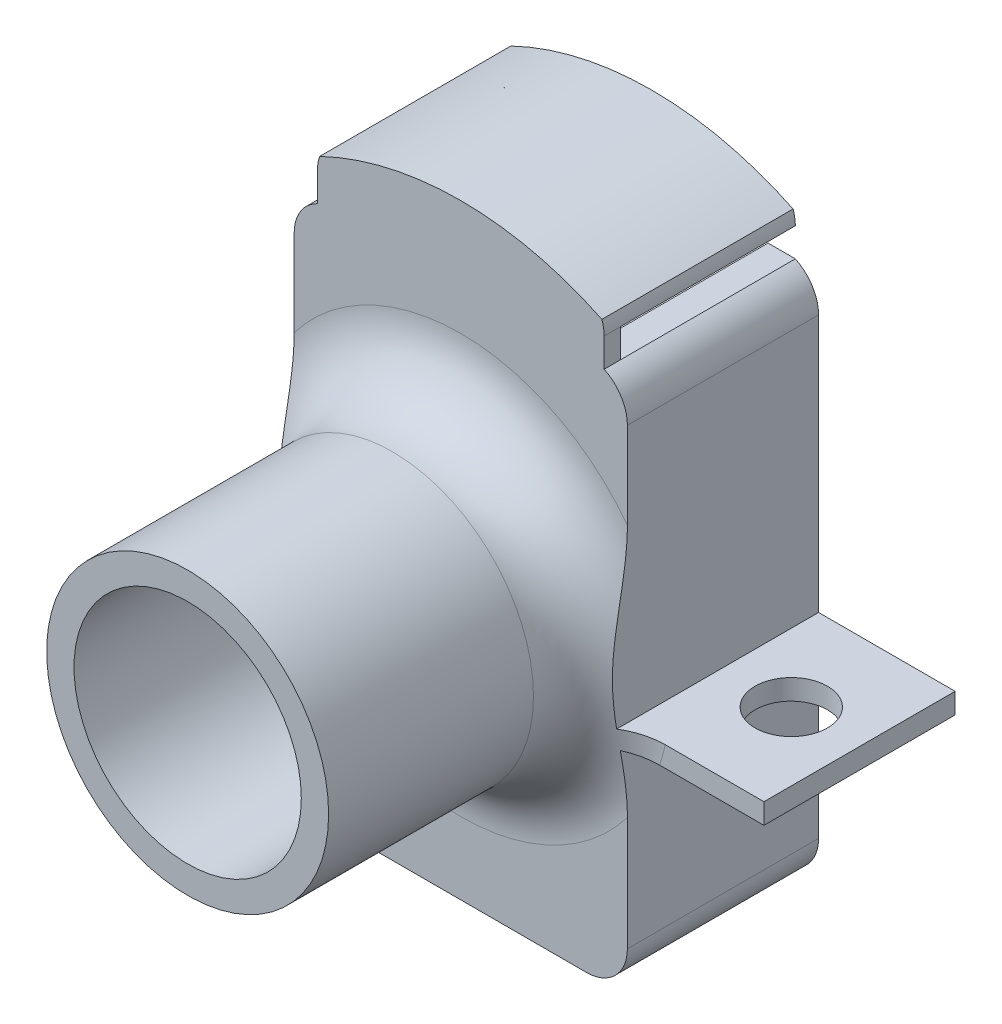
from build123d import *
from build123d.topology import SkipClean

# Parameters (mm, degrees)
SKETCH2_R             = 7.9375
BATTERY_HOLDER_DEPTH  = 16.256
CUT_EXTRUDE3_START    = -26.416
CUT_EXTRUDE3_DEPTH    = 26.416
SKETCH3_R             = 3.36804
PANEL_MOUNT_DEPTH     = 16.256
WINGS_DEPTH           = 1.27
ELECTRONIC_START      = -6.35
ELECTRONIC_AXIS_DEPTH = 6.35


with BuildPart() as part:
    # Sketch1 → Body (revolve)
    with BuildSketch(Plane(origin=(0, 0, 0), x_dir=(0, 0, -1), z_dir=(1, 0, 0))):
        with BuildLine():
            Line((0, 10.570464), (25.4, 10.570464))
            Line((25.4, 10.570464), (25.4, 7.9375))
            Line((25.4, 7.9375), (43.18, 7.9375))
            Line((43.18, 7.9375), (43.18, 30.1625))
            Line((43.18, 30.1625), (25.4, 30.1625))
            Line((25.4, 30.1625), (25.4, 19.460464))
            ThreePointArc((25.4, 19.460464), (23.540128061, 14.970335939), (19.05, 13.110464))
            Line((19.05, 13.110464), (0, 13.110464))
            Line((0, 13.110464), (0, 10.570464))
        make_face()
    revolve(axis=Axis((0, 0, 0), (0, 0, -1)))

    # Sketch2 → Battery holder (cut)
    with BuildSketch(Plane(origin=(0, 0, -43.18), x_dir=(-1, 0, 0), z_dir=(0, 0, -1))):
        with BuildLine():
            ThreePointArc((-12.954, -22.352), (-12.582025612, -23.250025612), (-11.684, -23.622))
            Line((-11.684, -23.622), (11.684, -23.622))
            ThreePointArc((11.684, -23.622), (12.582025612, -23.250025612), (12.954, -22.352))
            Line((12.954, -22.352), (12.954, 19.812))
            ThreePointArc((12.954, 19.812), (12.582025612, 20.710025612), (11.684, 21.082))
            Line((11.684, 21.082), (10.795, 21.082))
            Line((10.795, 21.082), (10.795, 25.908))
            ThreePointArc((10.795, 25.908), (10.423025612, 26.806025612), (9.525, 27.178))
            Line((9.525, 27.178), (-9.525, 27.178))
            ThreePointArc((-9.525, 27.178), (-10.423025612, 26.806025612), (-10.795, 25.908))
            Line((-10.795, 25.908), (-13.335, 25.908))
            Line((-13.335, 25.908), (-13.335, 23.245700482))
            Line((-13.335, 23.245700482), (-10.795, 23.245700482))
            Line((-10.795, 23.245700482), (-10.795, 21.082))
            Line((-10.795, 21.082), (-11.684, 21.082))
            ThreePointArc((-11.684, 21.082), (-12.582025612, 20.710025612), (-12.954, 19.812))
            Line((-12.954, 19.812), (-12.954, -22.352))
        make_face()
        Circle(SKETCH2_R, mode=Mode.SUBTRACT)
    extrude(amount=-BATTERY_HOLDER_DEPTH, mode=Mode.SUBTRACT)

    # Sketch2<3> → Cut-Extrude3 (cut)
    with BuildSketch(Plane(origin=(0, 0, -43.18), x_dir=(-1, 0, 0), z_dir=(0, 0, -1)).offset(CUT_EXTRUDE3_START)):
        with BuildLine():
            ThreePointArc((-15.494, 19.812), (-14.909399975, 21.840027367), (-13.335, 23.245700482))
            Line((-13.335, 23.245700482), (-13.335, 25.908))
            ThreePointArc((-13.335, 25.908), (-13.281952329, 26.54156862), (-13.124286511, 27.157494543))
            ThreePointArc((-13.124286511, 27.157494543), (-16.029895732, -25.550319941), (30.1625, 0))
            ThreePointArc((30.1625, 0), (25.550319941, 16.029895732), (13.124286511, 27.157494543))
            ThreePointArc((13.124286511, 27.157494543), (13.281952329, 26.54156862), (13.335, 25.908))
            Line((13.335, 25.908), (13.335, 23.245700482))
            ThreePointArc((13.335, 23.245700482), (14.909399975, 21.840027367), (15.494, 19.812))
            Line((15.494, 19.812), (15.494, -22.352))
            ThreePointArc((15.494, -22.352), (14.378076836, -25.046076836), (11.684, -26.162))
            Line((11.684, -26.162), (-11.684, -26.162))
            ThreePointArc((-11.684, -26.162), (-14.378076836, -25.046076836), (-15.494, -22.352))
            Line((-15.494, -22.352), (-15.494, -6.060125019))
            Line((-15.494, -6.060125019), (-28.194, -6.060125019))
            Line((-28.194, -6.060125019), (-28.194, -4.155125019))
            Line((-28.194, -4.155125019), (-15.494, -4.155125019))
            Line((-15.494, -4.155125019), (-15.494, 19.812))
        make_face()
    extrude(amount=CUT_EXTRUDE3_DEPTH, mode=Mode.SUBTRACT)

    # Sketch3 → Panel Mount (cut)
    with BuildSketch(Plane.XZ.offset(6.060125019)):
        with Locations((21.844, -34.29)):
            Circle(SKETCH3_R)
    extrude(amount=-PANEL_MOUNT_DEPTH, mode=Mode.SUBTRACT)

    # Sketch4 → Wings (add)
    with BuildSketch(Plane.XY.offset(-25.4)):
        with BuildLine():
            Line((1.2319, 9.300464), (1.2319, 10.49843472))
            ThreePointArc((1.2319, 10.49843472), (0, 10.570464), (-1.2319, 10.49843472))
            Line((-1.2319, 10.49843472), (-1.2319, 9.300464))
            ThreePointArc((-1.2319, 9.300464), (0, 8.068564), (1.2319, 9.300464))
        make_face()
        with BuildLine():
            ThreePointArc((-1.2319, -10.49843472), (0, -10.570464), (1.2319, -10.49843472))
            Line((1.2319, -10.49843472), (1.2319, -9.300464))
            ThreePointArc((1.2319, -9.300464), (0, -8.068564), (-1.2319, -9.300464))
            Line((-1.2319, -9.300464), (-1.2319, -10.49843472))
        make_face()
    extrude(amount=WINGS_DEPTH)

    # Sketch4<3> → Electronic Axis (cut)
    with SkipClean():  # the faces are left unmerged after this step: merging them gives an invalid solid
        with BuildSketch(Plane.XY.offset(-25.4).offset(ELECTRONIC_START)):
            with BuildLine():
                ThreePointArc((10.541437896, -0.782813043), (10.570464, 0), (10.541437896, 0.782813043))
                ThreePointArc((10.541437896, 0.782813043), (9.35050952, 1.852152848), (7.760951594, 1.664793261))
                ThreePointArc((7.760951594, 1.664793261), (7.9375, 0), (7.760951594, -1.664793261))
                ThreePointArc((7.760951594, -1.664793261), (9.35050952, -1.852152848), (10.541437896, -0.782813043))
            make_face()
            with BuildLine():
                ThreePointArc((-7.760951594, 1.664793261), (-9.35050952, 1.852152848), (-10.541437896, 0.782813043))
                ThreePointArc((-10.541437896, 0.782813043), (-10.570464, 0), (-10.541437896, -0.782813043))
                ThreePointArc((-10.541437896, -0.782813043), (-9.35050952, -1.852152848), (-7.760951594, -1.664793261))
                ThreePointArc((-7.760951594, -1.664793261), (-7.9375, 0), (-7.760951594, 1.664793261))
            make_face()
        extrude(amount=ELECTRONIC_AXIS_DEPTH, mode=Mode.SUBTRACT)


solid = part.part
